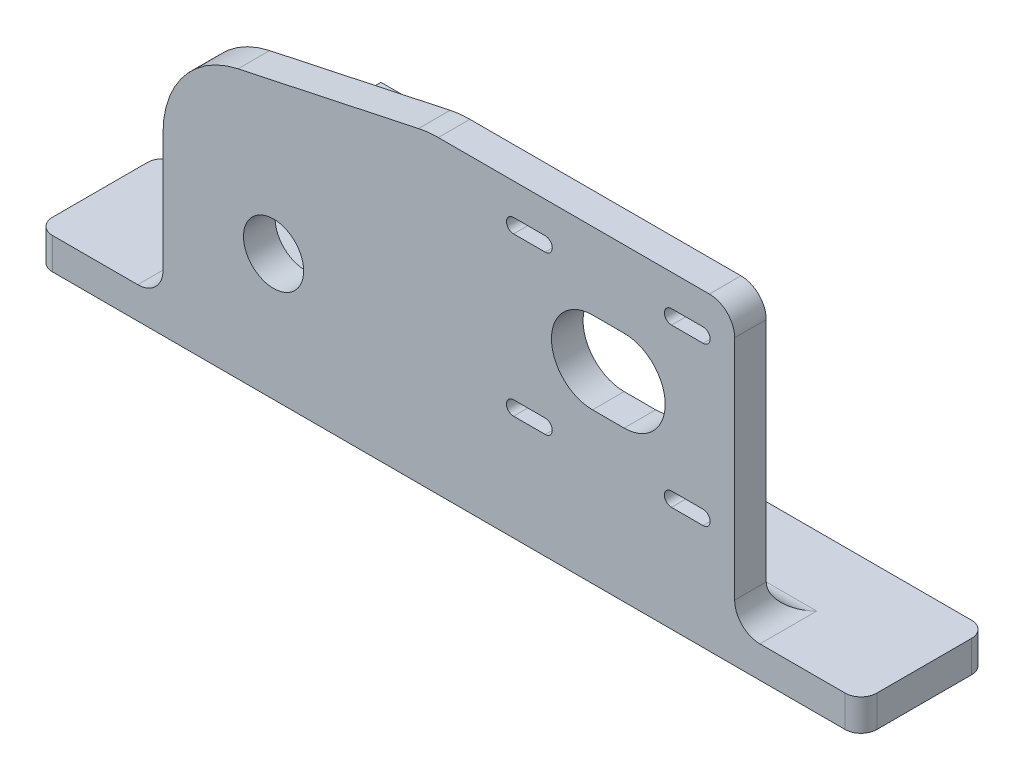
from build123d import *

# Parameters (mm, degrees)
SKETCH1_R           = 9.525
BOSS_EXTRUDE1_DEPTH = 10
SKETCH2_W           = 181
SKETCH2_H           = 100
BOSS_EXTRUDE2_DEPTH = 10
BOSS_EXTRUDE3_DEPTH = 18
SKETCH4_R           = 2
CUT_EXTRUDE1_DEPTH  = 30
SKETCH5_R           = 4
CUT_EXTRUDE2_DEPTH  = 20
CUT_EXTRUDE4_START  = -18
SKETCH8_W           = 62
SKETCH8_H           = 1
CUT_EXTRUDE4_DEPTH  = 18
CUT_EXTRUDE3_REACH  = 171.994
FILLET1_R           = 5
SKETCH9_W           = 40
SKETCH9_H           = 40
BOSS_EXTRUDE5_DEPTH = 10
CUT_EXTRUDE6_DEPTH  = 225.56428954
FILLET2_R           = 5
FILLET3_R           = 5
FILLET4_R           = 8
FILLET5_R           = 30


with BuildPart() as part:
    # Sketch1 → Boss-Extrude1 (new body)
    with BuildSketch(Plane.XY):
        Polygon((146, 57.938160866), (146, -30), (-35, -30), (-35, 40), (49, 57.938160866), align=None)
        Circle(SKETCH1_R, mode=Mode.SUBTRACT)
        with BuildLine():
            Line((101, 33.688160866), (111, 33.688160866))
            ThreePointArc((111, 33.688160866), (124, 20.688160866), (111, 7.688160866))
            Line((111, 7.688160866), (101, 7.688160866))
            ThreePointArc((101, 7.688160866), (88, 20.688160866), (101, 33.688160866))
        make_face(mode=Mode.SUBTRACT)
        with BuildLine():
            Line((86, 43.438160866), (76, 43.438160866))
            ThreePointArc((76, 43.438160866), (73.75, 45.688160866), (76, 47.938160866))
            Line((76, 47.938160866), (86, 47.938160866))
            ThreePointArc((86, 47.938160866), (88.25, 45.688160866), (86, 43.438160866))
        make_face(mode=Mode.SUBTRACT)
        with BuildLine():
            Line((86, -6.561839134), (76, -6.561839134))
            ThreePointArc((76, -6.561839134), (73.75, -4.311839134), (76, -2.061839134))
            Line((76, -2.061839134), (86, -2.061839134))
            ThreePointArc((86, -2.061839134), (88.25, -4.311839134), (86, -6.561839134))
        make_face(mode=Mode.SUBTRACT)
        with BuildLine():
            Line((126, -2.061839134), (136, -2.061839134))
            ThreePointArc((136, -2.061839134), (138.25, -4.311839134), (136, -6.561839134))
            Line((136, -6.561839134), (126, -6.561839134))
            ThreePointArc((126, -6.561839134), (123.75, -4.311839134), (126, -2.061839134))
        make_face(mode=Mode.SUBTRACT)
        with BuildLine():
            Line((126, 47.938160866), (136, 47.938160866))
            ThreePointArc((136, 47.938160866), (138.25, 45.688160866), (136, 43.438160866))
            Line((136, 43.438160866), (126, 43.438160866))
            ThreePointArc((126, 43.438160866), (123.75, 45.688160866), (126, 47.938160866))
        make_face(mode=Mode.SUBTRACT)
    extrude(amount=BOSS_EXTRUDE1_DEPTH)

    # Sketch2 → Boss-Extrude2 (add)
    with BuildSketch(Plane.XZ.offset(30)):
        with Locations((55.5, -40)):
            Rectangle(SKETCH2_W, SKETCH2_H)
    extrude(amount=BOSS_EXTRUDE2_DEPTH)

    # Sketch3 → Boss-Extrude3 (add)
    with BuildSketch(Plane.XY.offset(-55)):
        with BuildLine():
            Line((-31, 0), (-31, -40))
            Line((-31, -40), (31, -40))
            Line((31, -40), (31, 0))
            Line((31, 0), (19, 0))
            ThreePointArc((19, 0), (0, -19), (-19, 0))
            Line((-19, 0), (-31, 0))
        make_face()
    extrude(amount=BOSS_EXTRUDE3_DEPTH)

    # Sketch4 → Cut-Extrude1 (cut)
    with BuildSketch(Plane(origin=(0, 0, 0), x_dir=(1, 0, 0), z_dir=(0, 1, 0))):
        with Locations(Location((-25, 46, 0), (0, 0, 180))):
            Circle(SKETCH4_R)
        with Locations(Location((25, 46, 0), (0, 0, 180))):
            Circle(SKETCH4_R)
    extrude(amount=-CUT_EXTRUDE1_DEPTH, mode=Mode.SUBTRACT)

    # Sketch5 → Cut-Extrude2 (cut)
    with BuildSketch(Plane(origin=(0, -6, 0), x_dir=(1, 0, 0), z_dir=(0, 1, 0))):
        with Locations(Location((25, 46, 0), (0, 0, 180))):
            Circle(SKETCH5_R)
        with Locations(Location((-25, 46, 0), (0, 0, 180))):
            Circle(SKETCH5_R)
    extrude(amount=-CUT_EXTRUDE2_DEPTH, mode=Mode.SUBTRACT)

    # Sketch8 → Cut-Extrude4 (cut)
    with BuildSketch(Plane.XY.offset(-37).offset(CUT_EXTRUDE4_START)):
        with Locations((0, -0.5)):
            Rectangle(SKETCH8_W, SKETCH8_H)
    extrude(amount=CUT_EXTRUDE4_DEPTH, mode=Mode.SUBTRACT)

    # Sketch6 → Cut-Extrude3 (cut, up to next)
    with BuildSketch(Plane(origin=(0, 0, -55), x_dir=(-1, 0, 0), z_dir=(0, 0, -1)), mode=Mode.PRIVATE) as cut_extrude3_sk1:
        Polygon((31, -1), (20, -21), (20, -30), (31, -30), align=None)
    cut_extrude3_tool1 = extrude(cut_extrude3_sk1.sketch, amount=-CUT_EXTRUDE3_REACH, mode=Mode.PRIVATE) & part.part
    # Sketch6 → Cut-Extrude3 (cut, up to next)
    with BuildSketch(Plane(origin=(0, 0, -55), x_dir=(-1, 0, 0), z_dir=(0, 0, -1)), mode=Mode.PRIVATE) as cut_extrude3_sk2:
        Polygon((-31, -1), (-20, -21), (-20, -30), (-31, -30), align=None)
    cut_extrude3_tool2 = extrude(cut_extrude3_sk2.sketch, amount=-CUT_EXTRUDE3_REACH, mode=Mode.PRIVATE) & part.part
    add(cut_extrude3_tool1.solids().sort_by_distance((-26.464912, -19.622807, -55))[0], mode=Mode.SUBTRACT)
    add(cut_extrude3_tool2.solids().sort_by_distance((26.464912, -19.622807, -55))[0], mode=Mode.SUBTRACT)

    # Fillet1
    fillet1_edges = [part.edges().sort_by_distance(p)[0] for p in [
        (-20, -21, -46),
        (-20, -30, -46),
        (20, -30, -46),
        (20, -21, -46),
    ]]
    fillet(fillet1_edges, radius=FILLET1_R)

    # Sketch9 → Boss-Extrude5 (add)
    with BuildSketch(Plane.XZ.offset(40)):
        with Locations((-55, -10)):
            Rectangle(SKETCH9_W, SKETCH9_H)
        with Locations((166, -10)):
            Rectangle(SKETCH9_W, SKETCH9_H)
    extrude(amount=-BOSS_EXTRUDE5_DEPTH)

    # Sketch10 → Cut-Extrude6 (cut, through all)
    with BuildSketch(Plane(origin=(0, -30, 0), x_dir=(1, 0, 0), z_dir=(0, 1, 0))):
        Polygon((30, 30), (30, 60), (-35, 60), (-35, 90), (146, 90), (146, 30), align=None)
    extrude(amount=-CUT_EXTRUDE6_DEPTH, mode=Mode.SUBTRACT)

    # Fillet2
    fillet2_edges = [part.edges().sort_by_distance(p)[0] for p in [
        (-35, -35, -30),
        (-75, -35, -30),
        (-75, -35, 10),
        (186, -35, 10),
        (186, -35, -30),
        (-35, -35, -60),
        (30, -35, -30),
        (30, -35, -60),
    ]]
    fillet(fillet2_edges, radius=FILLET2_R)

    # Fillet3
    fillet3_edges = [part.edges().sort_by_distance(p)[0] for p in [
        (0, -30, -55),
        (0, -30, -37),
    ]]
    fillet(fillet3_edges, radius=FILLET3_R - 0.0001)  # a hair under: the kernel refuses the full size

    # Fillet4
    fillet4_edges = [part.edges().sort_by_distance(p)[0] for p in [
        (-35, -30, 5),
        (146, -30, 5),
        (55.5, -30, 0),
        (146, 57.938160866, 5),
    ]]
    fillet(fillet4_edges, radius=FILLET4_R)

    # Fillet5
    fillet5_edges = [part.edges().sort_by_distance(p)[0] for p in [
        (-35, 40, 5),
        (49, 57.938160866, 5),
    ]]
    fillet(fillet5_edges, radius=FILLET5_R)


solid = part.part
